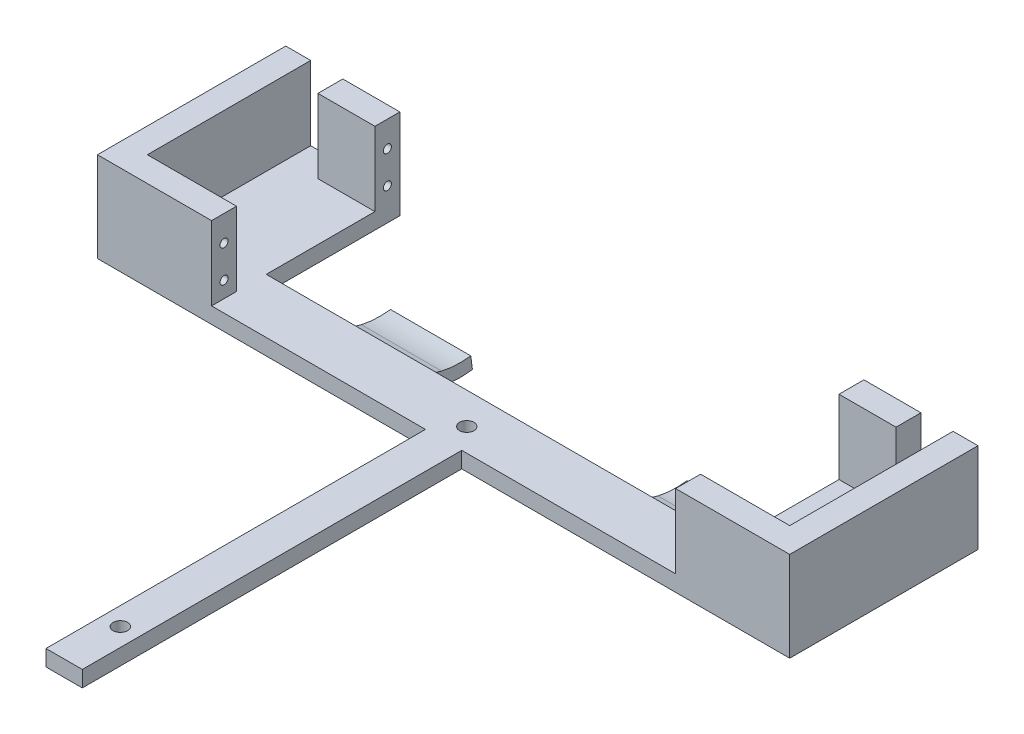
from build123d import *
from build123d.topology import SkipClean

# Parameters (mm, degrees)
BOSS_EXTRUDE1_DEPTH = 5
SKETCH7_W           = 17.76
SKETCH7_H           = 7.76
BOSS_EXTRUDE2_DEPTH = 23
SKETCH8_R           = 1.25
CUT_EXTRUDE1_DEPTH  = 5
CUT_EXTRUDE2_START  = -5
SKETCH9_R           = 1.25
CUT_EXTRUDE2_DEPTH  = 5
BOSS_EXTRUDE3_DEPTH = 25
FILLET1_R           = 22
FILLET2_R           = 30


with BuildPart() as part:
    # Sketch5 → Boss-Extrude1 (new body)
    with BuildSketch(Plane(origin=(0, 0, 0), x_dir=(1, 0, 0), z_dir=(0, 1, 0))):
        with BuildLine():
            Line((-7.71, 88.14), (-7.71, -30))
            Line((-7.71, -30), (-2.06, -30))
            Line((-2.06, -30), (-2.06, -14.77))
            ThreePointArc((-2.06, -14.77), (-4.31, -12.52), (-2.06, -10.27))
            Line((-2.06, -10.27), (-2.06, 93.1))
            ThreePointArc((-2.06, 93.1), (-4.31, 95.35), (-2.06, 97.6))
            Line((-2.06, 97.6), (-2.06, 105.16))
            Line((-2.06, 105.16), (-74.3, 105.16))
            Line((-74.3, 105.16), (-74.3, 146.76))
            Line((-74.3, 146.76), (-109.82, 146.76))
            Line((-109.82, 146.76), (-109.82, 88.14))
            Line((-109.82, 88.14), (-7.71, 88.14))
        make_face()
    boss_extrude1 = extrude(amount=BOSS_EXTRUDE1_DEPTH)

    # Sketch7 → Boss-Extrude2 (add)
    with BuildSketch(Plane(origin=(0, 5, 0), x_dir=(1, 0, 0), z_dir=(0, 1, 0))):
        Polygon((-109.82, 146.76), (-109.82, 88.14), (-74.3, 88.14), (-74.3, 95.9), (-102.06, 95.9), (-102.06, 146.76), align=None)
        with Locations((-83.18, 142.88)):
            Rectangle(SKETCH7_W, SKETCH7_H)
    boss_extrude2 = extrude(amount=BOSS_EXTRUDE2_DEPTH)

    # Sketch8 → Cut-Extrude1 (cut)
    with BuildSketch(Plane(origin=(-74.3, 0, 0), x_dir=(0, 0, -1), z_dir=(1, 0, 0))):
        with Locations((92.02, 10)):
            Circle(SKETCH8_R)
        with Locations((92.02, 20)):
            Circle(SKETCH8_R)
        with Locations((142.88, 10)):
            Circle(SKETCH8_R)
        with Locations((142.88, 20)):
            Circle(SKETCH8_R)
    extrude(amount=-CUT_EXTRUDE1_DEPTH, mode=Mode.SUBTRACT)

    # Mirror2: Boss-Extrude1, Boss-Extrude2 across plane
    with SkipClean():  # the faces are left unmerged after this step: merging them gives an invalid solid
        add(boss_extrude1.mirror(Plane(origin=(-2.06, 5, 0), x_dir=(0, 0, 1), z_dir=(1, 0, 0))))
        add(boss_extrude2.mirror(Plane(origin=(-2.06, 5, 0), x_dir=(0, 0, 1), z_dir=(1, 0, 0))))

    # Sketch9 → Cut-Extrude2 (cut)
    with SkipClean():  # the faces are left unmerged after this step: merging them gives an invalid solid
        with BuildSketch(Plane.ZY.offset(-70.18).offset(CUT_EXTRUDE2_START)):
            with Locations(Location((-142.88, 10, 0), (0, 0, 180))):
                Circle(SKETCH9_R)
            with Locations(Location((-142.88, 20, 0), (0, 0, 180))):
                Circle(SKETCH9_R)
            with Locations(Location((-92.02, 10, 0), (0, 0, 180))):
                Circle(SKETCH9_R)
            with Locations(Location((-92.02, 20, 0), (0, 0, 180))):
                Circle(SKETCH9_R)
        extrude(amount=CUT_EXTRUDE2_DEPTH, mode=Mode.SUBTRACT)

    # Sketch12 → Boss-Extrude3 (add)
    with SkipClean():  # the faces are left unmerged after this step: merging them gives an invalid solid
        with BuildSketch(Plane(origin=(-60.728648392, 0, 0), x_dir=(0, 0, -1), z_dir=(1, 0, 0))):
            with BuildLine():
                Line((130.792872119, -14.205030824), (130.268072642, -10.239607075))
                ThreePointArc((130.268072642, -10.239607075), (114.312520733, -7.123943435), (103.482147137, 5))
                Line((103.482147137, 5), (99.183531943, 5))
                ThreePointArc((99.183531943, 5), (111.604669447, -10.171432922), (130.792872119, -14.205030824))
            make_face()
        boss_extrude3 = extrude(amount=BOSS_EXTRUDE3_DEPTH)

    # Mirror3: Boss-Extrude3 across plane
    with SkipClean():  # the faces are left unmerged after this step: merging them gives an invalid solid
        add(boss_extrude3.mirror(Plane(origin=(-2.06, 0, 0), x_dir=(0, 0, 1), z_dir=(1, 0, 0))))

    # Fillet1
    # the kernel refuses this fillet: 22 mm, written as the material it adds along each edge
    with BuildSketch(Plane(origin=(-35.728648392, 1.749196605, -105.16), x_dir=(0, 1, 0), z_dir=(-1, 0, 0))) as fillet1_piece_1:
        with BuildLine():
            CenterArc((9.879940472, 20.977477008), FILLET1_R, 192.960861786, 59.501970429)
            Line((-11.559576515, 16.043197795), (-11.988366855, 15.94451221))
            ThreePointArc((-11.988366855, 15.94451221), (-7.755155531, 6.598291061), (-0.22933098, -0.375509389))
            Line((-0.22933098, -0.375509389), (0, -0.44))
            ThreePointArc((0, -0.44), (1.625401698, -0.44), (3.118220654, -0.41954954))
            Line((3.118220654, -0.41954954), (3.250803395, 0))
        make_face()
    extrude(amount=25)
    with BuildSketch(Plane(origin=(31.608648392, 1.749196605, -105.16), x_dir=(0, 1, 0), z_dir=(1, 0, 0))) as fillet1_piece_2:
        with BuildLine():
            CenterArc((9.879940472, -20.977477008), FILLET1_R, 107.537167785, 59.501970429)
            Line((-11.559576515, -16.043197795), (-11.988366855, -15.94451221))
            ThreePointArc((-11.988366855, -15.94451221), (-7.755155531, -6.598291061), (-0.22933098, 0.375509389))
            Line((-0.22933098, 0.375509389), (0, 0.44))
            ThreePointArc((0, 0.44), (1.625401698, 0.44), (3.118220654, 0.41954954))
            Line((3.118220654, 0.41954954), (3.250803395, 0))
        make_face()
    extrude(amount=25)

    # Fillet2
    # the kernel refuses this fillet: 30 mm, written as the material it adds along each edge
    with BuildSketch(Plane(origin=(-1.974069594, 0, -101.544349118), x_dir=(0, 0, 1), z_dir=(-1, 0, 0))) as fillet2_piece_1_section:
        with BuildLine():
            CenterArc((13.501831519, -30), FILLET2_R, 90, 40.801822192)
            ThreePointArc((-6.101508838, -7.290771769), (-2.755120907, -3.892795973), (0, 0))
            Line((0, 0), (13.501831519, 0))
        make_face()
    fillet2_piece_1 = extrude(amount=58.754578797, mode=Mode.PRIVATE)
    fillet2_piece_1 = split(fillet2_piece_1, bisect_by=Plane(origin=(-4.842034797, 0.299973601, -88.14), z_dir=(0, 0, 1)), keep=Keep.TOP, mode=Mode.PRIVATE)
    fillet2_piece_1 = split(fillet2_piece_1, bisect_by=Plane(origin=(-7.71, 0.299973601, -88.091260944), z_dir=(1, 0, 0)), keep=Keep.TOP, mode=Mode.PRIVATE)
    add(fillet2_piece_1)
    with BuildSketch(Plane(origin=(-35.728648392, 0, -101.544349118), x_dir=(0, 0, 1), z_dir=(-1, 0, 0))) as fillet2_piece_2_section:
        with BuildLine():
            CenterArc((13.501831519, -30), FILLET2_R, 90, 40.801822192)
            ThreePointArc((-6.101508838, -7.290771769), (-2.755120907, -3.892795973), (0, 0))
            Line((0, 0), (13.501831519, 0))
        make_face()
    fillet2_piece_2 = extrude(amount=25, mode=Mode.PRIVATE)
    fillet2_piece_2 = split(fillet2_piece_2, bisect_by=Plane(origin=(-48.228648392, -1.487894786, -88.14), z_dir=(0, 0, -1)), keep=Keep.TOP, mode=Mode.PRIVATE)
    add(fillet2_piece_2)
    with BuildSketch(Plane(origin=(-2.145930406, 0, -101.544349118), x_dir=(0, 0, 1), z_dir=(1, 0, 0))) as fillet2_piece_3_section:
        with BuildLine():
            CenterArc((13.501831519, 30), FILLET2_R, 229.198177808, 40.801822192)
            ThreePointArc((-6.101508838, 7.290771769), (-2.755120907, 3.892795973), (0, 0))
            Line((0, 0), (13.501831519, 0))
        make_face()
    fillet2_piece_3 = extrude(amount=58.754578797, mode=Mode.PRIVATE)
    fillet2_piece_3 = split(fillet2_piece_3, bisect_by=Plane(origin=(3.59, 0.299973601, -88.091260944), z_dir=(-1, 0, 0)), keep=Keep.TOP, mode=Mode.PRIVATE)
    fillet2_piece_3 = split(fillet2_piece_3, bisect_by=Plane(origin=(0.722034797, 0.299973601, -88.14), z_dir=(0, 0, 1)), keep=Keep.TOP, mode=Mode.PRIVATE)
    add(fillet2_piece_3)
    with BuildSketch(Plane(origin=(31.608648392, 0, -101.544349118), x_dir=(0, 0, 1), z_dir=(1, 0, 0))) as fillet2_piece_4_section:
        with BuildLine():
            CenterArc((13.501831519, 30), FILLET2_R, 229.198177808, 40.801822192)
            ThreePointArc((-6.101508838, 7.290771769), (-2.755120907, 3.892795973), (0, 0))
            Line((0, 0), (13.501831519, 0))
        make_face()
    fillet2_piece_4 = extrude(amount=25, mode=Mode.PRIVATE)
    fillet2_piece_4 = split(fillet2_piece_4, bisect_by=Plane(origin=(44.108648392, -1.487894786, -88.14), z_dir=(0, 0, -1)), keep=Keep.TOP, mode=Mode.PRIVATE)
    add(fillet2_piece_4)


solid = part.part
